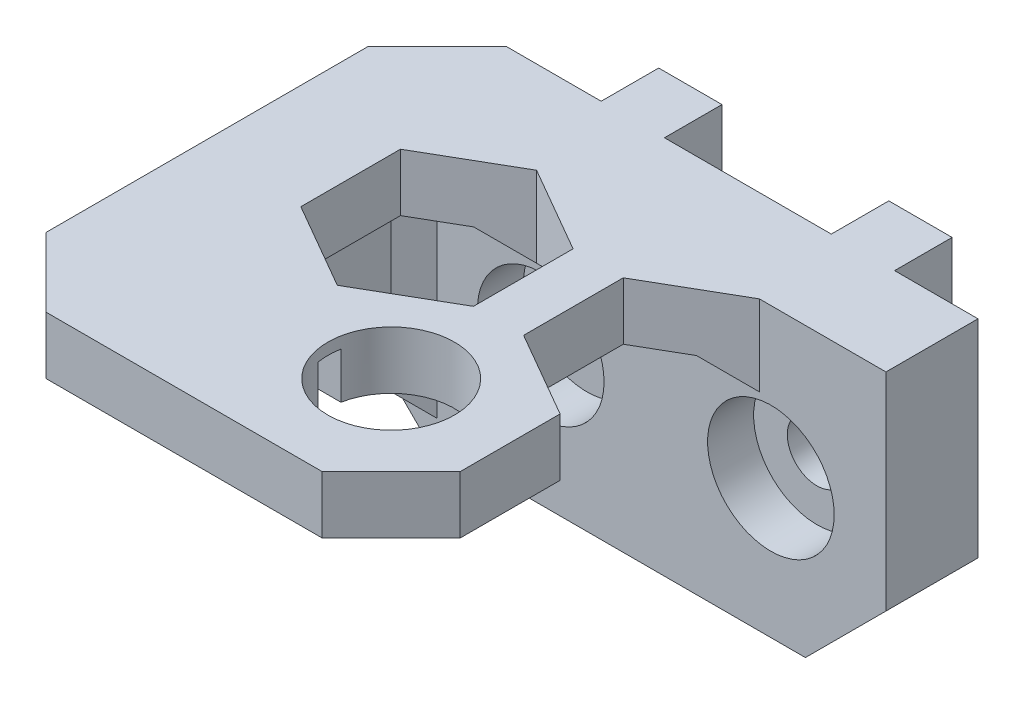
from build123d import *

# Parameters (mm, degrees)
BOSS_EXTRUDE1_DEPTH = 5
SKETCH3_W           = 47
SKETCH3_H           = 25
BOSS_EXTRUDE2_DEPTH = 8
RIB2_REACH          = 56.854
SKETCH9_WALL_W      = 137.164549338
SKETCH9_WALL_H      = 6
SKETCH2_R           = 5.5
SKETCH2_R_2         = 4.2
CUT_EXTRUDE1_DEPTH  = 5
SKETCH4_R           = 2.575
CUT_EXTRUDE2_DEPTH  = 8
SKETCH11_W          = 5.5
SKETCH11_H          = 5
BOSS_EXTRUDE5_DEPTH = 7
SKETCH12_R          = 4.941066883
BOSS_EXTRUDE6_DEPTH = 1
SKETCH7_R           = 5.5
CUT_EXTRUDE3_DEPTH  = 4
SKETCH10_W          = 11.059960659
SKETCH10_H          = 2
CUT_EXTRUDE4_DEPTH  = 4
CHAMFER1_SIZE       = 6
CHAMFER2_SIZE       = 7
CHAMFER4_SIZE       = 2
LPATTERN1_COUNT     = 2
LPATTERN1_PITCH     = 18
CHAMFER5_SIZE       = 2
CHAMFER6_SIZE       = 5


# Some blends are built 0.0001 mm under size
with BuildPart() as part:
    # Sketch1 → Boss-Extrude1 (new body)
    with BuildSketch(Plane(origin=(0, 0, 0), x_dir=(1, 0, 0), z_dir=(0, 1, 0))):
        Polygon((20, 20), (20, 12), (9, 12), (9, -20), (-27, -20), (-27, 20), align=None)
    extrude(amount=BOSS_EXTRUDE1_DEPTH)

    # Sketch3 → Boss-Extrude2 (add)
    with BuildSketch(Plane(origin=(0, 0, -20), x_dir=(-1, 0, 0), z_dir=(0, 0, -1))):
        with Locations((3.5, -7.5)):
            Rectangle(SKETCH3_W, SKETCH3_H)
    extrude(amount=-BOSS_EXTRUDE2_DEPTH)

    # Sketch9 wall → Rib2 (add, up to next)
    with BuildSketch(Plane(origin=(-27, -9, -3), x_dir=(0, 0.707106781187, 0.707106781187), z_dir=(0, 0.707106781187, -0.707106781187)), mode=Mode.PRIVATE) as rib2_sk1:
        with Locations((0, 3)):
            Rectangle(SKETCH9_WALL_W, SKETCH9_WALL_H)
    rib2_tool1 = extrude(rib2_sk1.sketch, amount=RIB2_REACH, mode=Mode.PRIVATE) - part.part
    add(rib2_tool1.solids().sort_by_distance((-27, -9, -3))[0])

    # Sketch2 → Cut-Extrude1 (cut)
    with BuildSketch(Plane(origin=(0, 5, 0), x_dir=(1, 0, 0), z_dir=(0, 1, 0))):
        with Locations(Location((-1, -10, 0), (0, 0, 270))):
            Circle(SKETCH2_R)
        with Locations(Location((-18.5, -10, 0), (0, 0, 270))):
            Circle(SKETCH2_R_2)
        Polygon((9, -5.320508076), (16.5, -0.990381057), (16.5, 7.669872981), (9, 12), (1.5, 7.669872981), (1.5, -0.990381057), align=None)
        Polygon((-10.36219397, -5.320508076), (-2.86219397, -0.990381057), (-2.86219397, 7.669872981), (-10.36219397, 12), (-17.86219397, 7.669872981), (-17.86219397, -0.990381057), align=None)
    extrude(amount=-CUT_EXTRUDE1_DEPTH, mode=Mode.SUBTRACT)

    # Sketch4 → Cut-Extrude2 (cut)
    with BuildSketch(Plane.XY.offset(-12)):
        with Locations((-10, -8)):
            Circle(SKETCH4_R)
        with Locations((10, -8)):
            Circle(SKETCH4_R)
    extrude(amount=-CUT_EXTRUDE2_DEPTH, mode=Mode.SUBTRACT)

    # Sketch11 → Boss-Extrude5 (add)
    with BuildSketch(Plane(origin=(0, 5, 0), x_dir=(1, 0, 0), z_dir=(0, 1, 0))):
        with Locations((-10, 22.5)):
            Rectangle(SKETCH11_W, SKETCH11_H)
        with Locations((10, 22.5)):
            Rectangle(SKETCH11_W, SKETCH11_H)
    boss_extrude5 = extrude(amount=-BOSS_EXTRUDE5_DEPTH)

    # Sketch12 → Boss-Extrude6 (add)
    with BuildSketch(Plane(origin=(0, 5, 0), x_dir=(1, 0, 0), z_dir=(0, 1, 0))):
        with Locations((-18.5, -10)):
            Circle(SKETCH12_R)
    extrude(amount=-BOSS_EXTRUDE6_DEPTH)

    # Sketch7 → Cut-Extrude3 (cut)
    with BuildSketch(Plane.XY.offset(-12)):
        with Locations((-10, -8)):
            Circle(SKETCH7_R)
        with Locations((10, -8)):
            Circle(SKETCH7_R)
    extrude(amount=-CUT_EXTRUDE3_DEPTH, mode=Mode.SUBTRACT)

    # Sketch10 → Cut-Extrude4 (cut)
    with BuildSketch(Plane.XZ):
        with Locations((-10.613093562, 9.96527114)):
            Rectangle(SKETCH10_W, SKETCH10_H)
    extrude(amount=-CUT_EXTRUDE4_DEPTH, mode=Mode.SUBTRACT)

    # Chamfer1
    chamfer1_edges = [part.edges().sort_by_distance(p)[0] for p in [
        (-27, -7.5, -20),
        (9, 2.5, 20),
        (-27, 2.5, 20),
    ]]
    chamfer(chamfer1_edges, length=CHAMFER1_SIZE)

    # Chamfer2
    chamfer2_edges = [part.edges().sort_by_distance(p)[0] for p in [
        (-27, -20, -13),
        (20, -20, -16),
    ]]
    chamfer(chamfer2_edges, length=CHAMFER2_SIZE)

    # Chamfer4
    # the kernel refuses this chamfer: 2 mm, written as the material it adds along each edge
    with BuildSketch(Plane(origin=(-19.666666667, -1.333333333, -10.666666667), x_dir=(-0.7071067811865462, -0.7071067811865488, 1.1932702685996668e-13), z_dir=(-0.5773502691896611, 0.5773502691895617, -0.5773502691896545))) as chamfer4_piece_1_section:
        Polygon((-1.414213562, 0.816496581), (1.414213562, 0.816496581), (0, -1.632993162), align=None)
    chamfer4_piece_1 = extrude(amount=2.540341184, mode=Mode.PRIVATE)
    chamfer4_piece_1 = split(chamfer4_piece_1, bisect_by=Plane(origin=(-21, 0, -12), z_dir=(0, -1, 0)), keep=Keep.TOP, mode=Mode.PRIVATE)
    chamfer4_piece_1 = split(chamfer4_piece_1, bisect_by=Plane(origin=(-21, 0, -12), z_dir=(1, 0, 0)), keep=Keep.TOP, mode=Mode.PRIVATE)
    chamfer4_piece_1 = split(chamfer4_piece_1, bisect_by=Plane(origin=(-21, 0, -12), z_dir=(0, 0, 1)), keep=Keep.TOP, mode=Mode.PRIVATE)
    add(chamfer4_piece_1)
    with BuildSketch(Plane(origin=(14.143365976, 0, -12), x_dir=(0, -0.9996219169112968, -0.027495876610586494), z_dir=(-1, 0, 0))) as chamfer4_piece_2_section:
        Polygon((CHAMFER4_SIZE * 0.999621916911, CHAMFER4_SIZE * 0.0274958766106), (-CHAMFER4_SIZE * 0.0274958766106, CHAMFER4_SIZE * 0.999621916911), (0, 0), align=None)
    chamfer4_piece_2 = extrude(amount=24.505559946, mode=Mode.PRIVATE)
    chamfer4_piece_2 = split(chamfer4_piece_2, bisect_by=Plane(origin=(1.470049267, -0.68923776, -7.652580917), z_dir=(-0.5000000000000001, 0, -0.8660254037844387)), keep=Keep.TOP, mode=Mode.PRIVATE)
    chamfer4_piece_2 = split(chamfer4_piece_2, bisect_by=Plane(origin=(-2.832243237, -0.68923776, -7.652580917), z_dir=(0.5000000000000001, 0, -0.8660254037844386)), keep=Keep.TOP, mode=Mode.PRIVATE)
    add(chamfer4_piece_2)
    with BuildSketch(Plane(origin=(-21, -23.143365976, -12), x_dir=(0.9996219169112965, 0, -0.027495876610597728), z_dir=(0, 1, 0))) as chamfer4_piece_3_section:
        Polygon((CHAMFER4_SIZE * 0.999621916911, -CHAMFER4_SIZE * 0.0274958766106), (-CHAMFER4_SIZE * 0.0274958766106, -CHAMFER4_SIZE * 0.999621916911), (0, 0), align=None)
    chamfer4_piece_3 = extrude(amount=23.143365976, mode=Mode.PRIVATE)
    chamfer4_piece_3 = split(chamfer4_piece_3, bisect_by=Plane(origin=(-20.326923077, -13.009615385, -7.009615385), z_dir=(0, 0.7071067811865476, -0.7071067811865476)), keep=Keep.TOP, mode=Mode.PRIVATE)
    add(chamfer4_piece_3)
    with BuildSketch(Plane(origin=(-21, 0, -17.143365976), x_dir=(0.9996219169112968, 0.02749587661058649, 0), z_dir=(0, 0, 1))) as chamfer4_piece_4_section:
        Polygon((CHAMFER4_SIZE * 0.999621916911, -CHAMFER4_SIZE * 0.0274958766106), (-CHAMFER4_SIZE * 0.0274958766106, -CHAMFER4_SIZE * 0.999621916911), (0, 0), align=None)
    chamfer4_piece_4 = extrude(amount=28.286731952, mode=Mode.PRIVATE)
    chamfer4_piece_4 = split(chamfer4_piece_4, bisect_by=Plane(origin=(-20.327046258, -4.990950262, 1.009049738), z_dir=(0, 0.7071067811865476, -0.7071067811865476)), keep=Keep.TOP, mode=Mode.PRIVATE)
    chamfer4_piece_4 = chamfer4_piece_4 - Plane(origin=(-18.5, -0.653916776, 10), x_dir=(0, 0, 1), z_dir=(0, 1, 0)) * Cylinder(4.2, 65, mode=Mode.PRIVATE)
    add(chamfer4_piece_4)
    with BuildSketch(Plane(origin=(-10.36219397, 0, -12), x_dir=(0, -0.9996219169112998, -0.027495876610477744), z_dir=(-1, 0, 0))) as chamfer4_piece_5_section:
        Polygon((CHAMFER4_SIZE * 0.999621916911, CHAMFER4_SIZE * 0.0274958766106), (-CHAMFER4_SIZE * 0.0274958766105, CHAMFER4_SIZE * 0.999621916911), (0, 0), align=None)
    chamfer4_piece_5 = extrude(amount=15.781172006, mode=Mode.PRIVATE)
    chamfer4_piece_5 = split(chamfer4_piece_5, bisect_by=Plane(origin=(-15.029121281, -0.686960661, -9.305548261), z_dir=(-0.5000000000000003, 0, -0.8660254037844387)), keep=Keep.TOP, mode=Mode.PRIVATE)
    add(chamfer4_piece_5)

    # LPattern1: Boss-Extrude5 ×2
    with Locations(*[(0, -i * LPATTERN1_PITCH, 0) for i in range(1, LPATTERN1_COUNT)]):
        add(boss_extrude5)

    # Chamfer5
    chamfer5_edges = [part.edges().sort_by_distance(p)[0] for p in [
        (-10, -2, -25),
        (10, -2, -25),
    ]]
    chamfer(chamfer5_edges, length=CHAMFER5_SIZE)

    # Chamfer6
    chamfer6_edges = [part.edges().sort_by_distance(p)[0] for p in [
        (-10, -13, -25),
        (10, -13, -25),
    ]]
    chamfer(chamfer6_edges, length=CHAMFER6_SIZE - 0.0001)  # a hair under: the kernel refuses the full size


solid = part.part
